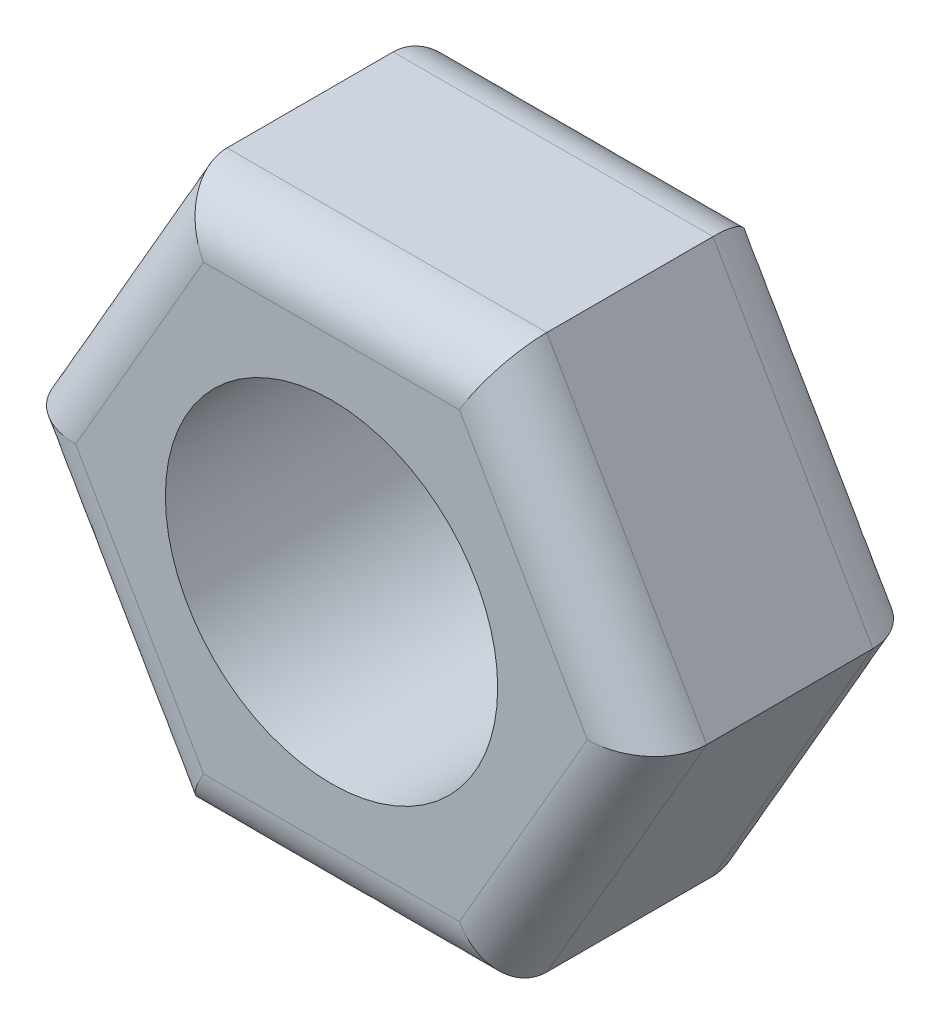
from build123d import *

# Parameters (mm, degrees)
SKETCH1_R           = 1.5
BOSS_EXTRUDE1_DEPTH = 2.5
VARFILLET1_R        = 0.5


with BuildPart() as part:
    # Sketch1 → Boss-Extrude1 (new body)
    with BuildSketch(Plane.XY):
        Polygon((2.886751346, 0), (1.443375673, 2.5), (-1.443375673, 2.5), (-2.886751346, 0), (-1.443375673, -2.5), (1.443375673, -2.5), align=None)
        Circle(SKETCH1_R, mode=Mode.SUBTRACT)
    extrude(amount=BOSS_EXTRUDE1_DEPTH)

    # VarFillet1
    varfillet1_edges = [part.edges().sort_by_distance(p)[0] for p in [
        (-2.165063509, 1.25, 0),
        (0, 2.5, 0),
        (2.165063509, 1.25, 2.5),
        (2.165063509, -1.25, 2.5),
        (0, -2.5, 2.5),
        (-2.165063509, -1.25, 2.5),
        (-2.165063509, 1.25, 2.5),
        (0, 2.5, 2.5),
        (2.165063509, 1.25, 0),
        (2.165063509, -1.25, 0),
        (0, -2.5, 0),
        (-2.165063509, -1.25, 0),
    ]]
    fillet(varfillet1_edges, radius=VARFILLET1_R)


solid = part.part
